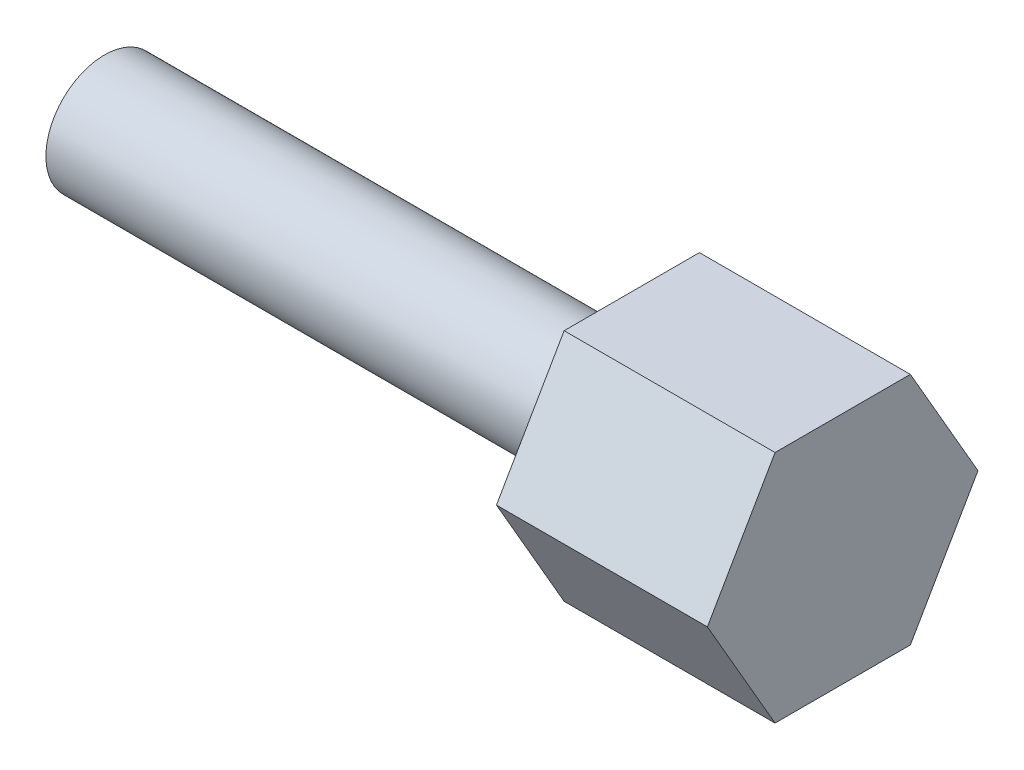
from build123d import *

# Parameters (mm, degrees)
BOSS_EXTRUDE1_DEPTH = 11.43
SKETCH1_3_R         = 3.175
BOSS_EXTRUDE2_DEPTH = 28.575


with BuildPart() as part:
    # Sketch1 → Boss-Extrude1 (new body)
    with BuildSketch(Plane(origin=(0, 0, 0), x_dir=(0, 0, -1), z_dir=(1, 0, 0))):
        Polygon((7.332348419, 0), (3.666174209, 6.35), (-3.666174209, 6.35), (-7.332348419, 0), (-3.666174209, -6.35), (3.666174209, -6.35), align=None)
    extrude(amount=BOSS_EXTRUDE1_DEPTH)

    # Sketch1<3> → Boss-Extrude2 (add)
    with BuildSketch(Plane(origin=(0, 0, 0), x_dir=(0, 0, -1), z_dir=(1, 0, 0))):
        Circle(SKETCH1_3_R)
    extrude(amount=-BOSS_EXTRUDE2_DEPTH)


solid = part.part
